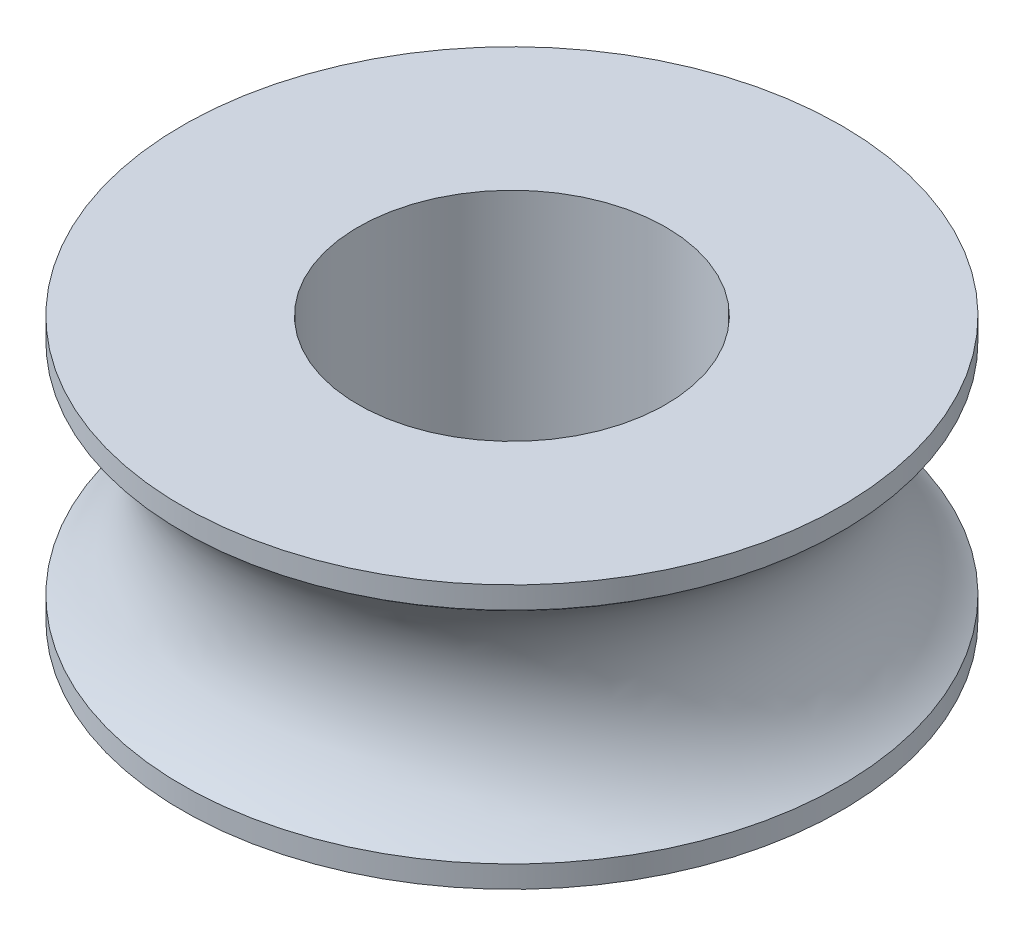
from build123d import *


with BuildPart() as part:
    # Sketch1 → Revolve1 (revolve)
    with BuildSketch(Plane.XY):
        with BuildLine():
            Line((-2.5, 0), (-7.5, 0))
            Line((-7.5, 0), (-7.5, 0.5))
            ThreePointArc((-7.5, 0.5), (-6.158312395, 3), (-7.5, 5.5))
            Line((-7.5, 5.5), (-7.5, 6))
            Line((-7.5, 6), (-3.5, 6))
            Line((-3.5, 6), (-3.5, 1))
            Line((-3.5, 1), (-2.5, 1))
            Line((-2.5, 1), (-2.5, 0))
        make_face()
    revolve(axis=Axis((0, -6.629530881, 0), (0, 1, 0)))


solid = part.part
